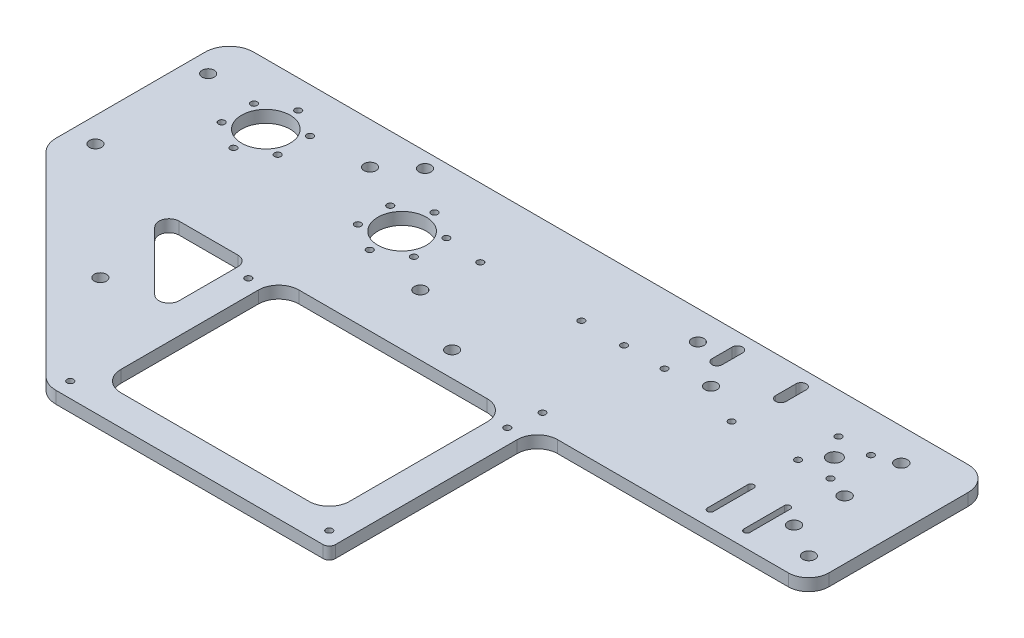
from build123d import *

# Parameters (mm, degrees)
ESBO_O1_R                = 1.6
ESBO_O1_R_2              = 3
ESBO_O1_R_3              = 12
ESBO_O1_R_4              = 3.5
ESBO_O1_R_5              = 3.05
RESSALTO_EXTRUS_O1_DEPTH = 6
ESBO_O2_R                = 3
CORTE_EXTRUS_O1_DEPTH    = 10


with BuildPart() as part:
    # Esboço1 → Ressalto-extrusão1 (new body)
    with BuildSketch(Plane(origin=(0, 0, 0), x_dir=(1, 0, 0), z_dir=(0, 1, 0))):
        with BuildLine():
            Line((-80.557360207, -153.648697641), (51.472077044, -153.648697641))
            ThreePointArc((51.472077044, -153.648697641), (53.593397388, -152.770017984), (54.472077044, -150.648697641))
            Line((54.472077044, -150.648697641), (54.472077044, -60.788592817))
            ThreePointArc((54.472077044, -60.788592817), (57.401009232, -53.717525005), (64.472077044, -50.788592817))
            Line((64.472077044, -50.788592817), (178.527922956, -50.788592817))
            ThreePointArc((178.527922956, -50.788592817), (185.598990768, -47.859660628), (188.527922956, -40.788592817))
            Line((188.527922956, -40.788592817), (188.527922956, 28))
            ThreePointArc((188.527922956, 28), (185.01320433, 36.485281374), (176.527922956, 40))
            Line((176.527922956, 40), (-176.527922956, 40))
            ThreePointArc((-176.527922956, 40), (-185.01320433, 36.485281374), (-188.527922956, 28))
            Line((-188.527922956, 28), (-188.527922956, -45.678134892))
            ThreePointArc((-188.527922956, -45.678134892), (-187.614477346, -50.270336081), (-185.01320433, -54.163416267))
            Line((-185.01320433, -54.163416267), (-89.042641582, -150.133979015))
            ThreePointArc((-89.042641582, -150.133979015), (-85.149561396, -152.735252031), (-80.557360207, -153.648697641))
        make_face()
        with Locations((-81.027922956, -58.148697641)):
            Circle(ESBO_O1_R, mode=Mode.SUBTRACT)
        with Locations((-81.027922956, -146.148697641)):
            Circle(ESBO_O1_R, mode=Mode.SUBTRACT)
        with Locations((46.972077044, -58.148697641)):
            Circle(ESBO_O1_R, mode=Mode.SUBTRACT)
        with Locations((46.972077044, -146.148697641)):
            Circle(ESBO_O1_R, mode=Mode.SUBTRACT)
        with Locations((176.311042956, -38.431817641)):
            Circle(ESBO_O1_R_2, mode=Mode.SUBTRACT)
        with Locations((0, -38.431817641)):
            Circle(ESBO_O1_R_2, mode=Mode.SUBTRACT)
        with Locations((-140.527922956, 10)):
            Circle(ESBO_O1_R_3, mode=Mode.SUBTRACT)
        with Locations((-140.527922956, -6)):
            Circle(ESBO_O1_R, mode=Mode.SUBTRACT)
        with Locations((-154.384329416, 2)):
            Circle(ESBO_O1_R, mode=Mode.SUBTRACT)
        with Locations((-154.384329416, 18)):
            Circle(ESBO_O1_R, mode=Mode.SUBTRACT)
        with Locations((-84.367438628, 32.5)):
            Circle(ESBO_O1_R_2, mode=Mode.SUBTRACT)
        with Locations((-176.311042956, -38.431817641)):
            Circle(ESBO_O1_R_2, mode=Mode.SUBTRACT)
        with Locations((140.527922956, 10)):
            Circle(ESBO_O1_R_4, mode=Mode.SUBTRACT)
        with Locations((148.527922956, 0)):
            Circle(ESBO_O1_R, mode=Mode.SUBTRACT)
        with Locations((148.527922956, 20)):
            Circle(ESBO_O1_R, mode=Mode.SUBTRACT)
        with Locations((132.527922956, 0)):
            Circle(ESBO_O1_R, mode=Mode.SUBTRACT)
        with Locations((132.527922956, 20)):
            Circle(ESBO_O1_R, mode=Mode.SUBTRACT)
        with Locations((-140.527922956, 26)):
            Circle(ESBO_O1_R, mode=Mode.SUBTRACT)
        with Locations((-126.671516495, 18)):
            Circle(ESBO_O1_R, mode=Mode.SUBTRACT)
        with Locations((-126.671516495, 2)):
            Circle(ESBO_O1_R, mode=Mode.SUBTRACT)
        with Locations((-63.17160518, -16)):
            Circle(ESBO_O1_R, mode=Mode.SUBTRACT)
        with Locations((-77.02801164, -8)):
            Circle(ESBO_O1_R, mode=Mode.SUBTRACT)
        with Locations((-77.02801164, 8)):
            Circle(ESBO_O1_R, mode=Mode.SUBTRACT)
        with Locations((-63.17160518, 16)):
            Circle(ESBO_O1_R, mode=Mode.SUBTRACT)
        with Locations((-49.315198719, 8)):
            Circle(ESBO_O1_R, mode=Mode.SUBTRACT)
        with Locations((-49.315198719, -8)):
            Circle(ESBO_O1_R, mode=Mode.SUBTRACT)
        with Locations((-63.17160518, 0)):
            Circle(ESBO_O1_R_3, mode=Mode.SUBTRACT)
        with Locations((-33.527922956, -20.648697641)):
            Circle(ESBO_O1_R_2, mode=Mode.SUBTRACT)
        with Locations((79.527922956, 10)):
            Circle(ESBO_O1_R_2, mode=Mode.SUBTRACT)
        with Locations((99.722077044, 0)):
            Circle(ESBO_O1_R, mode=Mode.SUBTRACT)
        with Locations((49.222077044, -43)):
            Circle(ESBO_O1_R, mode=Mode.SUBTRACT)
        with Locations((-30.527922956, 6)):
            Circle(ESBO_O1_R, mode=Mode.SUBTRACT)
        with Locations((19.472077044, 6)):
            Circle(ESBO_O1_R, mode=Mode.SUBTRACT)
        with Locations((60.527922956, 6)):
            Circle(ESBO_O1_R, mode=Mode.SUBTRACT)
        with Locations((40.527922956, 6)):
            Circle(ESBO_O1_R, mode=Mode.SUBTRACT)
        with Locations((159.467922956, 24.07)):
            Circle(ESBO_O1_R_5, mode=Mode.SUBTRACT)
        with Locations((159.467922956, -3.93)):
            Circle(ESBO_O1_R_5, mode=Mode.SUBTRACT)
        with Locations((159.467922956, -28.93)):
            Circle(ESBO_O1_R_5, mode=Mode.SUBTRACT)
        with Locations((-178.527922956, 19.5)):
            Circle(ESBO_O1_R_2, mode=Mode.SUBTRACT)
        with Locations((-98.527922956, 19.5)):
            Circle(ESBO_O1_R_2, mode=Mode.SUBTRACT)
        with Locations((57.327922956, 25.68)):
            Circle(ESBO_O1_R_2, mode=Mode.SUBTRACT)
        with BuildLine():
            Line((-122.576844598, -50.788592817), (-93.527922956, -50.788592817))
            ThreePointArc((-93.527922956, -50.788592817), (-89.99238905, -52.253058911), (-88.527922956, -55.788592817))
            Line((-88.527922956, -55.788592817), (-88.527922956, -84.837514459))
            ThreePointArc((-88.527922956, -84.837514459), (-91.614505794, -89.456912121), (-97.063456862, -88.373048365))
            Line((-97.063456862, -88.373048365), (-126.112378504, -59.324126723))
            ThreePointArc((-126.112378504, -59.324126723), (-127.196242261, -53.875175655), (-122.576844598, -50.788592817))
        make_face(mode=Mode.SUBTRACT)
        with BuildLine():
            Line((39.472077044, -60.648697641), (39.472077044, -128.648697641))
            ThreePointArc((39.472077044, -128.648697641), (36.543144856, -135.719765453), (29.472077044, -138.648697641))
            Line((29.472077044, -138.648697641), (-63.527922956, -138.648697641))
            ThreePointArc((-63.527922956, -138.648697641), (-70.598990768, -135.719765453), (-73.527922956, -128.648697641))
            Line((-73.527922956, -128.648697641), (-73.527922956, -60.648697641))
            ThreePointArc((-73.527922956, -60.648697641), (-70.598990768, -53.577629829), (-63.527922956, -50.648697641))
            Line((-63.527922956, -50.648697641), (29.472077044, -50.648697641))
            ThreePointArc((29.472077044, -50.648697641), (36.543144856, -53.577629829), (39.472077044, -60.648697641))
        make_face(mode=Mode.SUBTRACT)
        with BuildLine():
            Line((148.722077044, -43), (148.722077044, -23))
            ThreePointArc((148.722077044, -23), (150.222077044, -21.5), (151.722077044, -23))
            Line((151.722077044, -23), (151.722077044, -43))
            ThreePointArc((151.722077044, -43), (150.222077044, -44.5), (148.722077044, -43))
        make_face(mode=Mode.SUBTRACT)
        with BuildLine():
            Line((133.722077044, -43), (133.722077044, -23))
            ThreePointArc((133.722077044, -23), (132.222077044, -21.5), (130.722077044, -23))
            Line((130.722077044, -23), (130.722077044, -43))
            ThreePointArc((130.722077044, -43), (132.222077044, -44.5), (133.722077044, -43))
        make_face(mode=Mode.SUBTRACT)
        with BuildLine():
            Line((67.977922956, 22), (67.977922956, 32))
            ThreePointArc((67.977922956, 32), (70.527922956, 34.55), (73.077922956, 32))
            Line((73.077922956, 32), (73.077922956, 22))
            ThreePointArc((73.077922956, 22), (70.527922956, 19.45), (67.977922956, 22))
        make_face(mode=Mode.SUBTRACT)
        with BuildLine():
            Line((99.477922956, 22), (99.477922956, 32))
            ThreePointArc((99.477922956, 32), (102.027922956, 34.55), (104.577922956, 32))
            Line((104.577922956, 32), (104.577922956, 22))
            ThreePointArc((104.577922956, 22), (102.027922956, 19.45), (99.477922956, 22))
        make_face(mode=Mode.SUBTRACT)
    extrude(amount=-RESSALTO_EXTRUS_O1_DEPTH)

    # Esboço2 → Corte-extrusão1 (cut)
    with BuildSketch(Plane(origin=(0, 0, 0), x_dir=(1, 0, 0), z_dir=(0, 1, 0))):
        with Locations((-117.838060117, -94.468502794)):
            Circle(ESBO_O2_R)
    extrude(amount=-CORTE_EXTRUS_O1_DEPTH, mode=Mode.SUBTRACT)


solid = part.part
